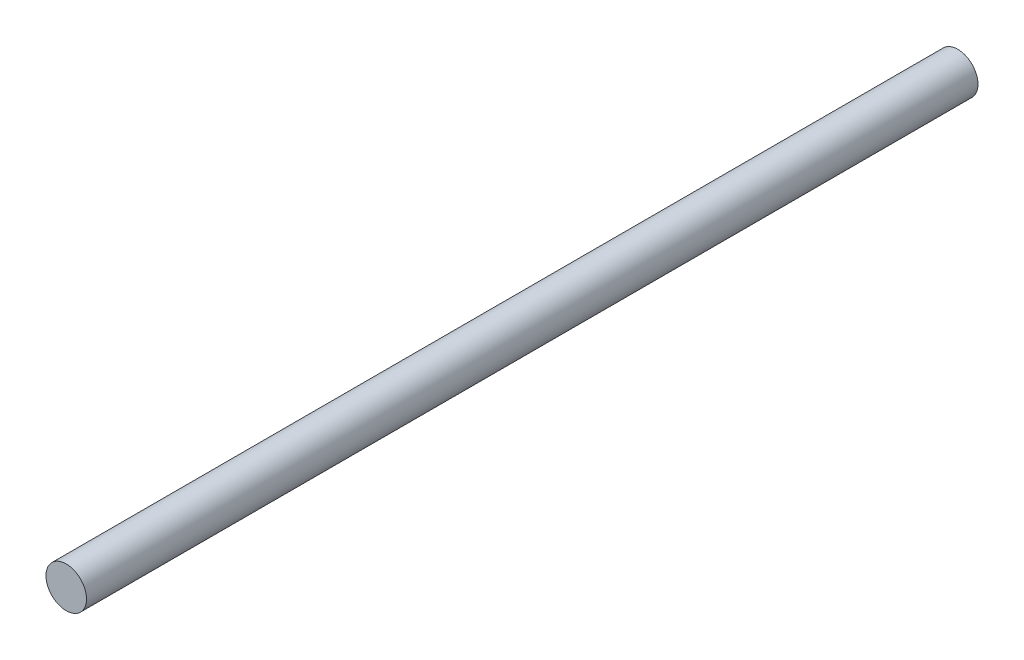
from build123d import *

# Parameters (mm, degrees)
SKETCH2_R           = 3.175
BOSS_EXTRUDE1_DEPTH = 139.7


with BuildPart() as part:
    # Sketch2 → Boss-Extrude1 (new body)
    with BuildSketch(Plane.XY):
        Circle(SKETCH2_R)
    extrude(amount=BOSS_EXTRUDE1_DEPTH)


solid = part.part
